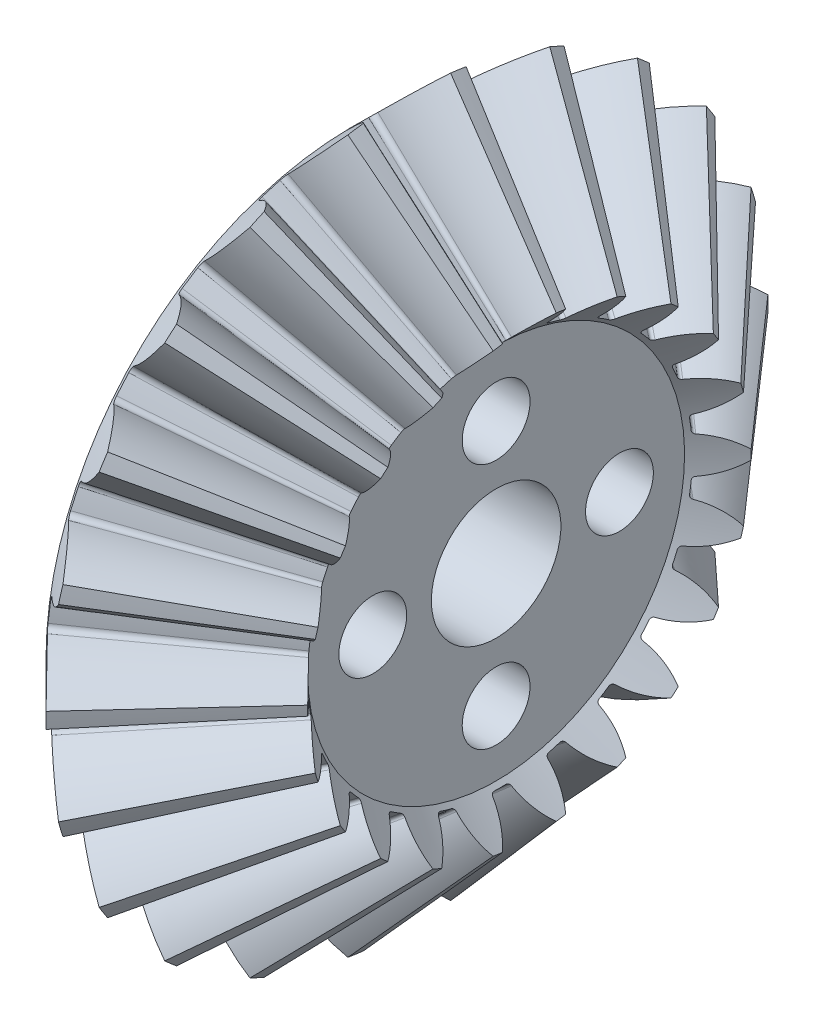
from build123d import *

# Parameters (mm, degrees)
TEETHCUTS_COUNT    = 22
TEETHCUTS_ANGLE    = 343.636363636
HUBSKE_R           = 7.5
HUB_DEPTH          = 0.0001016
BORSKE_R           = 3.15
BORE_DEPTH         = 18.076015039
SKETCH1_R          = 1.65
CUT_EXTRUDE1_DEPTH = 26.707211641
CIRPATTERN1_COUNT  = 4


with BuildPart() as part:
    # BasProSke → Base-Revolve (revolve)
    with BuildSketch(Plane(origin=(0, 0, 0), x_dir=(1, 0, 0), z_dir=(0, 1, 0)), mode=Mode.PRIVATE) as base_revolve_sk:
        Polygon((0, 0), (0, 14.924035763), (2.636624413, 17.560660171), (8.591494528, 10.787608225), (6.971801935, 9.167915636), (6.971801935, 0), align=None)
    revolve(base_revolve_sk.sketch.rotate(Axis((-10, 0, 0), (1, 0, 0)), 180), axis=Axis((-10, 0, 0), (1, 0, 0)))

    # ToothCut: read off the stored shape, not the designer's step
    # ToothCut: loft between two sections, ruled curve by curve
    toothcut_from = [
        Edge.make_bspline([(18.082098387, 0.006134148, -0.009275457), (18.07784036, 0.00187612, -0.014907403), (18.072039145, -0.003925095, -0.014087509), (18.068653428, -0.007310812, -0.007375262)], [0, 0, 0, 0, 1, 1, 1, 1], 3, [1, 0.772537019, 0.772537019, 1]),
        Edge.make_bspline([(18.068653428, -0.007310812, 0.007375262), (18.072039145, -0.003925095, 0.014087509), (18.07784036, 0.00187612, 0.014907403), (18.082098387, 0.006134148, 0.009275457)], [0, 0, 0, 0, 1, 1, 1, 1], 3, [1, 0.772537019, 0.772537019, 1]),
        Edge.make_bspline([(18.068653428, -0.007310812, -0.007375262), (18.06817062, -0.00779362, -0.006418087), (18.067785821, -0.008178419, -0.005375854), (18.067506392, -0.008457848, -0.004268501)], [0, 0, 0, 0, 1, 1, 1, 1], 3, [1, 0.993623092, 0.993623092, 1]),
        Edge.make_bspline([(18.067506392, -0.008457848, 0.004268501), (18.067785821, -0.008178419, 0.005375854), (18.06817062, -0.00779362, 0.006418087), (18.068653428, -0.007310812, 0.007375262)], [0, 0, 0, 0, 1, 1, 1, 1], 3, [1, 0.993623092, 0.993623092, 1]),
        Edge.make_bspline([(18.067506392, -0.008457848, -0.004268501), (18.066802802, -0.009161438, -0.001480242), (18.066802802, -0.009161438, 0.001480242), (18.067506392, -0.008457848, 0.004268501)], [0, 0, 0, 0, 1, 1, 1, 1], 3, [1, 0.961216951, 0.961216951, 1]),
        Edge.make_line((18.082098387, 0.006134148, 0.009275457), (18.082098387, 0.006134148, -0.009275457)),
    ]
    toothcut_to = [
        Edge.make_bspline([(2.781352887, 17.705388644, -2.383135833), (2.132498331, 17.05653409, -1.532918876), (1.342545241, 16.266581002, -0.970032052), (0.473268726, 15.397304488, -0.738493666)], [0, 0, 0, 0, 1, 1, 1, 1], 3, [1, 0.973933005, 0.973933005, 1]),
        Edge.make_bspline([(0.473268726, 15.397304488, 0.738493666), (1.342545241, 16.266581002, 0.970032052), (2.132498331, 17.05653409, 1.532918876), (2.781352887, 17.705388644, 2.383135833)], [0, 0, 0, 0, 1, 1, 1, 1], 3, [1, 0.973933005, 0.973933005, 1]),
        Edge.make_bspline([(0.473268726, 15.397304488, -0.738493666), (0.371801263, 15.295837026, -0.711467038), (0.307121152, 15.231156914, -0.597648338), (0.310290169, 15.234325932, -0.451697507)], [0, 0, 0, 0, 1, 1, 1, 1], 3, [1, 0.839921023, 0.839921023, 1]),
        Edge.make_bspline([(0.310290169, 15.234325932, 0.451697507), (0.307121152, 15.231156914, 0.597648338), (0.371801263, 15.295837026, 0.711467038), (0.473268726, 15.397304488, 0.738493666)], [0, 0, 0, 0, 1, 1, 1, 1], 3, [1, 0.839921023, 0.839921023, 1]),
        Edge.make_bspline([(0.310290169, 15.234325932, -0.451697507), (0.316827588, 15.24086335, -0.15061314), (0.316827588, 15.24086335, 0.15061314), (0.310290169, 15.234325932, 0.451697507)], [0, 0, 0, 0, 1, 1, 1, 1], 3, [1, 0.999685922, 0.999685922, 1]),
        Edge.make_line((2.781352887, 17.705388644, 2.383135833), (2.781352887, 17.705388644, -2.383135833)),
    ]
    toothcut = Solid(Shell([*[Face.make_surface_from_curves(toothcut_from[k], toothcut_to[k]) for k in range(6)], Face(Wire(toothcut_from)), Face(Wire(toothcut_to))]))
    add(toothcut, mode=Mode.SUBTRACT)

    # TeethCuts: ToothCut ×22 about axis
    teethcuts_axis = Axis((-10, 0, 0), (1, 0, 0))
    for i in range(1, TEETHCUTS_COUNT):
        add(toothcut.rotate(teethcuts_axis, i * TEETHCUTS_ANGLE / (TEETHCUTS_COUNT - 1)), mode=Mode.SUBTRACT)

    # HubSke → Hub (add)
    with BuildSketch(Plane.ZY):
        with Locations(Location((0, 0, 0), (0, 0, 180))):
            Circle(HUBSKE_R)
    extrude(amount=HUB_DEPTH)

    # BorSke → Bore (cut, symmetric)
    with BuildSketch(Plane(origin=(0, 0, 0), x_dir=(0, 0, -1), z_dir=(1, 0, 0))):
        with Locations(Location((0, 0, 0), (0, 0, 180))):
            Circle(BORSKE_R)
    extrude(amount=BORE_DEPTH, both=True, mode=Mode.SUBTRACT)

    # Sketch1 → Cut-Extrude1 (cut, through all)
    with BuildSketch(Plane(origin=(6.971801935, 0, 0), x_dir=(0, 0, -1), z_dir=(1, 0, 0))):
        with Locations((0, 6)):
            Circle(SKETCH1_R)
    cut_extrude1 = extrude(amount=-CUT_EXTRUDE1_DEPTH, mode=Mode.SUBTRACT)

    # CirPattern1: Cut-Extrude1 ×4 about axis
    cirpattern1_axis = Axis((0, 0, 0), (1, 0, 0))
    for i in range(1, CIRPATTERN1_COUNT):
        add(cut_extrude1.rotate(cirpattern1_axis, i * 360 / CIRPATTERN1_COUNT), mode=Mode.SUBTRACT)


solid = part.part
